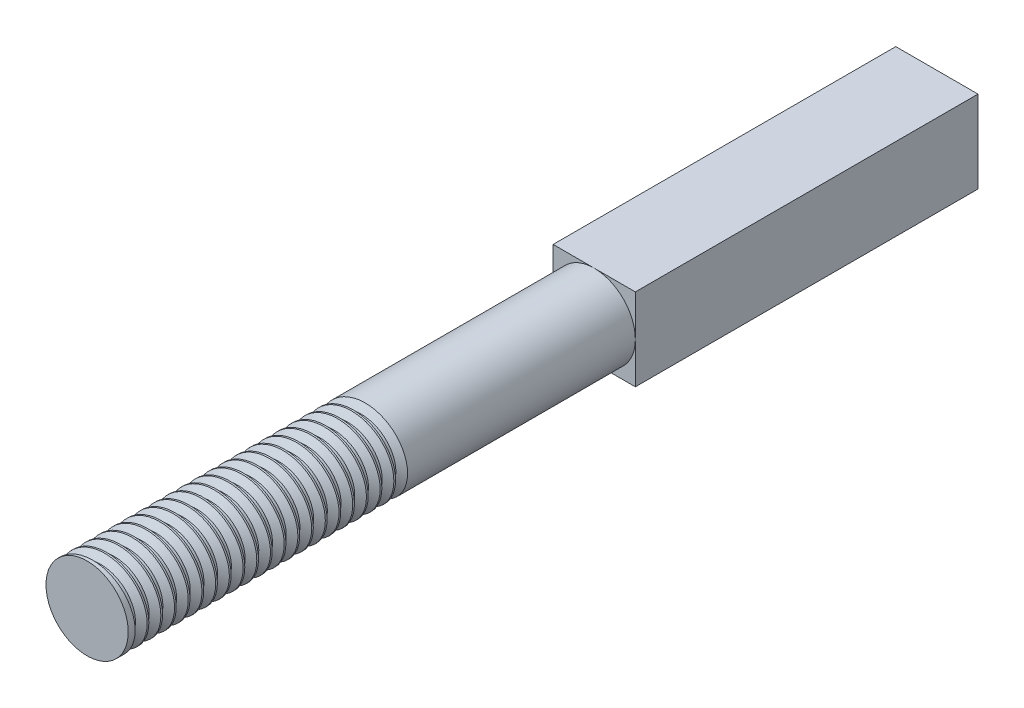
from build123d import *

# Parameters (mm, degrees)
SKETCH4_W           = 6
SKETCH4_H           = 6
BOSS_EXTRUDE3_DEPTH = 25
SKETCH5_R           = 3
BOSS_EXTRUDE4_DEPTH = 17
SKETCH6_R           = 3
BOSS_EXTRUDE5_DEPTH = 20
THREAD1_PITCH       = 1


with BuildPart() as part:
    # Sketch4 → Boss-Extrude3 (new body)
    with BuildSketch(Plane.XY):
        Rectangle(SKETCH4_W, SKETCH4_H)
    extrude(amount=BOSS_EXTRUDE3_DEPTH)

    # Sketch5 → Boss-Extrude4 (add)
    with BuildSketch(Plane.XY.offset(25)):
        Circle(SKETCH5_R)
    extrude(amount=BOSS_EXTRUDE4_DEPTH)

    # Sketch6 → Boss-Extrude5 (add)
    with BuildSketch(Plane.XY.offset(42)):
        Circle(SKETCH6_R)
    extrude(amount=BOSS_EXTRUDE5_DEPTH)

    # Thread1: the profile of Thread Profile1 profile screwed along a right-hand helix of 20 turns, 8 arcs to a turn; built about Z, then put on its axis
    thread1_z = Axis((0, 0, 0), (0, 0, 1))
    thread1_corners = [(3.0003, 0, -0.000173), (3.0003, 0, 0.875173), (2.458734, 0, 0.5625), (2.458734, 0, 0.3125)]
    with BuildLine(mode=Mode.PRIVATE) as thread1_profile:
        Line(thread1_corners[0], thread1_corners[1])
        Line(thread1_corners[1], thread1_corners[2])
        Line(thread1_corners[2], thread1_corners[3])
        Line(thread1_corners[3], thread1_corners[0])
    thread1_cap = Face(thread1_profile.wire())
    thread1_turn_angles = [0, 22.5, 45, 67.5, 90, 112.5, 135, 157.5, 180, 202.5, 225, 247.5, 270, 292.5, 315, 337.5, 360]
    thread1_turn_weights = [1, 0.9238795325112867, 1, 0.9238795325112867, 1, 0.9238795325112867, 1, 0.9238795325112867, 1, 0.9238795325112867, 1, 0.9238795325112867, 1, 0.9238795325112867, 1, 0.9238795325112867, 1]
    thread1_turn_rails = [Edge.make_bspline([Vector(p[0], p[1], 0).rotate(thread1_z, thread1_turn_angles[k]) / thread1_turn_weights[k] + Vector(0, 0, p[2] + THREAD1_PITCH * thread1_turn_angles[k] / 360) for k in range(17)], [0, 0, 0, 1, 1, 2, 2, 3, 3, 4, 4, 5, 5, 6, 6, 7, 7, 8, 8, 8], 2, thread1_turn_weights) for p in thread1_corners]
    thread1_turn_sides = [Face.make_surface_from_curves(thread1_turn_rails[p[0]], thread1_turn_rails[p[1]]) for p in [(0, 1), (1, 2), (2, 3), (3, 0)]]
    thread1 = Plane(origin=(0, 0, 62), x_dir=(-1, 0, 0), z_dir=(0, 0, -1)) * Solid(Shell([*[p.moved(Location((0, 0, THREAD1_PITCH * i))) for i in range(20) for p in thread1_turn_sides], thread1_cap, thread1_cap.rotate(thread1_z, 7200).moved(Location((0, 0, THREAD1_PITCH * 7200 / 360)))]))
    add(thread1, mode=Mode.SUBTRACT)


solid = part.part
